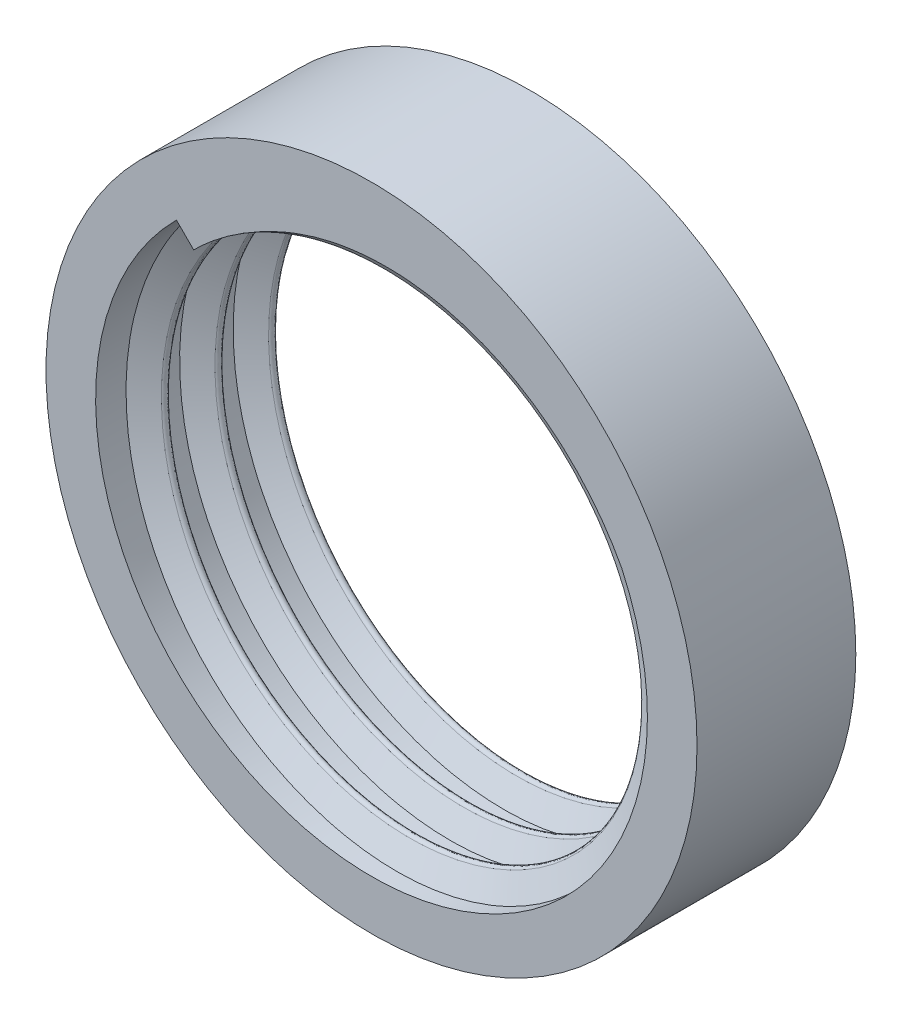
from build123d import *

# Parameters (mm, degrees)
SKIZZE1_R                       = 16.4
SKIZZE1_R_2                     = 13.9
AUFSATZ_LINEAR_AUSTRAGEN1_DEPTH = 8
AUSTRAGUNG1_PITCH               = 2.7
SKIZZE12_R                      = 16.4
SCHNITT_LINEAR_AUSTRAGEN1_DEPTH = 29.770872691
SKIZZE13_R                      = 16.4
SCHNITT_LINEAR_AUSTRAGEN2_DEPTH = 25.887077917


with BuildPart() as part:
    # Skizze1 → Aufsatz-Linear austragen1 (new body)
    with BuildSketch(Plane.XY):
        Circle(SKIZZE1_R)
        Circle(SKIZZE1_R_2, mode=Mode.SUBTRACT)
    extrude(amount=AUFSATZ_LINEAR_AUSTRAGEN1_DEPTH)

    # Austragung1: arcs per turn and ends read off the stored shape
    # Austragung1: the profile of Skizze10 profile screwed along a right-hand helix through 6 turns, 10 arcs to a turn; built about Z, then put on its axis
    austragung1_z = Axis((0, 0, 0), (0, 0, 1))
    austragung1_corners = [(12.771058084, -0.005352076, 0.173122371), (13.900299994, -0.025498039, 0.82477916), (13.900299994, 0.025498039, -0.82477916), (12.771058084, 0.005352076, -0.173122371), (12.671058084, 0, 0)]
    with BuildLine(mode=Mode.PRIVATE) as austragung1_profile:
        Line(austragung1_corners[0], austragung1_corners[1])
        Line(austragung1_corners[1], austragung1_corners[2])
        Line(austragung1_corners[2], austragung1_corners[3])
        ThreePointArc((12.771058084, 0.005352076, -0.173122371), (12.697853003, 0.003090023, -0.099952247), (12.671058084, 0, 0))
        ThreePointArc((12.671058084, 0, 0), (12.697853003, -0.003090023, 0.099952247), (12.771058084, -0.005352076, 0.173122371))
    austragung1_cap = Face(austragung1_profile.wire())
    austragung1_arcs = [((12.771058084, 0.005352076, -0.173122371), (12.671058084, 0.003568051, -0.115414914), (12.671058084, 0, 0), (1, 0.8660254037844388, 1)), ((12.671058084, 0, 0), (12.671058084, -0.003568051, 0.115414914), (12.771058084, -0.005352076, 0.173122371), (1, 0.8660254037844388, 1))]  # start, shoulder, end, weights
    austragung1_turn_angles = [0, 18, 36, 54, 72, 90, 108, 126, 144, 162, 180, 198, 216, 234, 252, 270, 288, 306, 324, 342, 360]
    austragung1_turn_weights = [1, 0.9510565162951535, 1, 0.9510565162951535, 1, 0.9510565162951535, 1, 0.9510565162951535, 1, 0.9510565162951535, 1, 0.9510565162951535, 1, 0.9510565162951535, 1, 0.9510565162951535, 1, 0.9510565162951535, 1, 0.9510565162951535, 1]
    austragung1_turn_rails = [Edge.make_bspline([Vector(p[0], p[1], 0).rotate(austragung1_z, austragung1_turn_angles[k]) / austragung1_turn_weights[k] + Vector(0, 0, p[2] + AUSTRAGUNG1_PITCH * austragung1_turn_angles[k] / 360) for k in range(21)], [0, 0, 0, 1, 1, 2, 2, 3, 3, 4, 4, 5, 5, 6, 6, 7, 7, 8, 8, 9, 9, 10, 10, 10], 2, austragung1_turn_weights) for p in austragung1_corners]
    austragung1_turn_sides = [*[Face.make_surface_from_curves(austragung1_turn_rails[p[0]], austragung1_turn_rails[p[1]]) for p in [(0, 1), (1, 2), (2, 3)]], *[Face.make_bezier_surface([[Vector(p[j][0], p[j][1], 0).rotate(austragung1_z, austragung1_turn_angles[2 * i + k]) / austragung1_turn_weights[2 * i + k] + Vector(0, 0, p[j][2] + AUSTRAGUNG1_PITCH * austragung1_turn_angles[2 * i + k] / 360) for k in range(3)] for j in range(3)], [[p[3][j] * austragung1_turn_weights[2 * i + k] for k in range(3)] for j in range(3)]) for p in austragung1_arcs for i in range(10)]]
    austragung1 = Plane(origin=(0, 0, 8), x_dir=(-0.7071067811865512, 0.7071067811865438, 0), z_dir=(0, 0, -1)) * Solid(Shell([*[p.moved(Location((0, 0, AUSTRAGUNG1_PITCH * i))) for i in range(6) for p in austragung1_turn_sides], austragung1_cap, austragung1_cap.rotate(austragung1_z, 2160).moved(Location((0, 0, AUSTRAGUNG1_PITCH * 2160 / 360)))]))
    add(austragung1)

    # Skizze12 → Schnitt-Linear austragen1 (cut, through all)
    with BuildSketch(Plane.XY.offset(8)):
        Circle(SKIZZE12_R)
    extrude(amount=SCHNITT_LINEAR_AUSTRAGEN1_DEPTH, mode=Mode.SUBTRACT)

    # Skizze13 → Schnitt-Linear austragen2 (cut, through all)
    with BuildSketch(Plane(origin=(0, 0, 0), x_dir=(-1, 0, 0), z_dir=(0, 0, -1))):
        with Locations(Location((0, 0, 0), (0, 0, 180))):
            Circle(SKIZZE13_R)
    extrude(amount=SCHNITT_LINEAR_AUSTRAGEN2_DEPTH, mode=Mode.SUBTRACT)


solid = part.part
